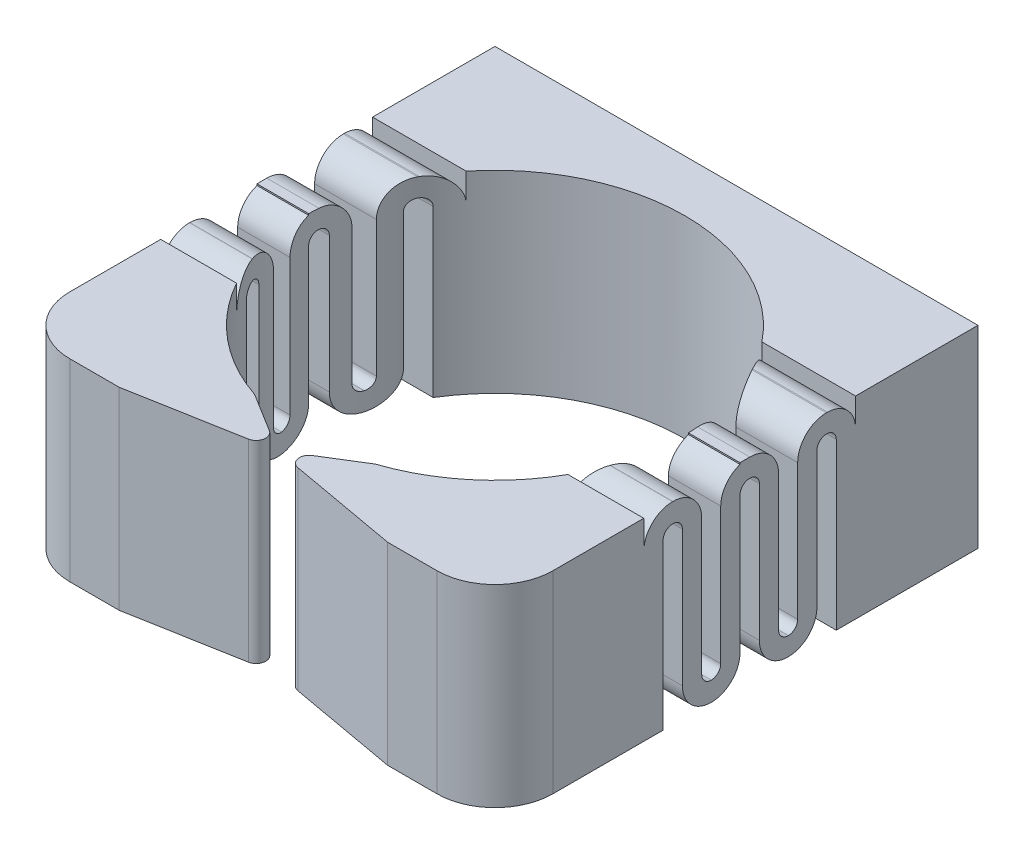
from build123d import *

# Parameters (mm, degrees)
BOSS_EXTRUDE1_DEPTH = 10
CUT_EXTRUDE1_START  = -25
CUT_EXTRUDE1_DEPTH  = 25


# Read off the part's stored shape, not the designer's step: Cut-Extrude1
with BuildPart() as part:
    # Sketch1 → Boss-Extrude1 (new body)
    with BuildSketch(Plane(origin=(0, 0, 0), x_dir=(1, 0, 0), z_dir=(0, 1, 0))):
        with BuildLine():
            Line((9.5, -12.5), (6.94861032, -12.5))
            Line((6.94861032, -12.5), (1.283416566, -11.480876482))
            ThreePointArc((1.283416566, -11.480876482), (0.88076591, -11.082297837), (1.108770113, -10.563639404))
            Line((1.108770113, -10.563639404), (3.120925069, -9.318057602))
            ThreePointArc((3.120925069, -9.318057602), (0, 9.826818955), (-3.120925069, -9.318057602))
            Line((-3.120925069, -9.318057602), (-1.108770113, -10.563639404))
            ThreePointArc((-1.108770113, -10.563639404), (-0.88076591, -11.082297837), (-1.283416566, -11.480876482))
            Line((-1.283416566, -11.480876482), (-6.94861032, -12.5))
            Line((-6.94861032, -12.5), (-9.5, -12.5))
            ThreePointArc((-9.5, -12.5), (-11.621320344, -11.621320344), (-12.5, -9.5))
            Line((-12.5, -9.5), (-12.5, 12.5))
            Line((-12.5, 12.5), (12.5, 12.5))
            Line((12.5, 12.5), (12.5, -9.5))
            ThreePointArc((12.5, -9.5), (11.621320344, -11.621320344), (9.5, -12.5))
        make_face()
    extrude(amount=BOSS_EXTRUDE1_DEPTH)

    # Cut-Extrude1 outline → Cut-Extrude1 (cut)
    with BuildSketch(Plane(origin=(12.5, 0, 0), x_dir=(0, 0, -1), z_dir=(1, 0, 0)).offset(CUT_EXTRUDE1_START)):
        with BuildLine():
            ThreePointArc((0.184141938, 1.49), (-0.252268958, 0.436410896), (-1.305858062, 0))
            Line((-1.305858062, 0), (5.164141938, 0))
            Line((5.164141938, 0), (5.164141938, 8.558404603))
            ThreePointArc((5.164141938, 8.558404603), (5.020624261, 8.904886926), (4.674141938, 9.048404603))
            Line((4.674141938, 9.048404603), (4.654141938, 9.048404603))
            ThreePointArc((4.654141938, 9.048404603), (4.307659615, 8.904886926), (4.164141938, 8.558404603))
            Line((4.164141938, 8.558404603), (4.164141938, 1.538404603))
            ThreePointArc((4.164141938, 1.538404603), (3.734825681, 0.491823997), (2.694141938, 0.048404603))
            Line((2.694141938, 0.048404603), (2.674141938, 0.048404603))
            ThreePointArc((2.674141938, 0.048404603), (1.620552834, 0.484815499), (1.184141938, 1.538404603))
            Line((1.184141938, 1.538404603), (1.184141938, 8.558404603))
            ThreePointArc((1.184141938, 8.558404603), (1.040624261, 8.904886926), (0.694141938, 9.048404603))
            Line((0.694141938, 9.048404603), (0.674141938, 9.048404603))
            ThreePointArc((0.674141938, 9.048404603), (0.327659615, 8.904886926), (0.184141938, 8.558404603))
            Line((0.184141938, 8.558404603), (0.184141938, 1.49))
        make_face()
        with BuildLine():
            Line((-3.798254746, 0), (-1.308254746, 0))
            ThreePointArc((-1.308254746, 0), (-2.36184385, 0.436410896), (-2.798254746, 1.49))
            Line((-2.798254746, 1.49), (-2.798254746, 8.51))
            ThreePointArc((-2.798254746, 8.51), (-2.941772423, 8.856482323), (-3.288254746, 9))
            Line((-3.288254746, 9), (-3.308254685, 9))
            ThreePointArc((-3.308254685, 9), (-3.654737047, 8.856482344), (-3.798254746, 8.51))
            Line((-3.798254746, 8.51), (-3.798254746, 0))
        make_face()
        with BuildLine():
            ThreePointArc((-0.815858062, 8.557281282), (-0.533122657, 9.399639929), (0.184141938, 9.924081442))
            Line((0.184141938, 9.924081442), (0.184141938, 10))
            Line((0.184141938, 10), (-3.288254746, 10))
            ThreePointArc((-3.288254746, 10), (-2.234665642, 9.563589104), (-1.798254746, 8.51))
            Line((-1.798254746, 8.51), (-1.798254746, 1.49))
            ThreePointArc((-1.798254746, 1.49), (-1.654737069, 1.143517678), (-1.308254746, 1))
            Line((-1.308254746, 1), (-1.305858062, 1))
            ThreePointArc((-1.305858062, 1), (-0.959375739, 1.143517677), (-0.815858062, 1.49))
            Line((-0.815858062, 1.49), (-0.815858062, 8.557281282))
        make_face()
        with BuildLine():
            ThreePointArc((-4.798254746, 8.51), (-4.36184385, 9.563589104), (-3.308254746, 10))
            Line((-3.308254746, 10), (-4.798254746, 10))
            Line((-4.798254746, 10), (-4.798254746, 8.51))
        make_face()
        with BuildLine():
            Line((6.164141938, 10), (4.719392839, 10))
            ThreePointArc((4.719392839, 10), (5.734112549, 9.571397228), (6.164141938, 8.557281282))
            Line((6.164141938, 8.557281282), (6.164141938, 10))
        make_face()
        with BuildLine():
            Line((4.656538621, 10), (0.691745254, 10))
            ThreePointArc((0.691745254, 10), (1.745334358, 9.563589104), (2.181745254, 8.51))
            Line((2.181745254, 8.51), (2.181745254, 1.49))
            ThreePointArc((2.181745254, 1.49), (2.325262932, 1.143517677), (2.671745254, 1))
            Line((2.671745254, 1), (2.691745203, 0.999999998))
            ThreePointArc((2.691745203, 0.999999998), (3.028438371, 1.14878509), (3.166538621, 1.49))
            Line((3.166538621, 1.49), (3.166538621, 8.51))
            ThreePointArc((3.166538621, 8.51), (3.602949517, 9.563589104), (4.656538621, 10))
        make_face()
    extrude(amount=CUT_EXTRUDE1_DEPTH, mode=Mode.SUBTRACT)


solid = part.part
